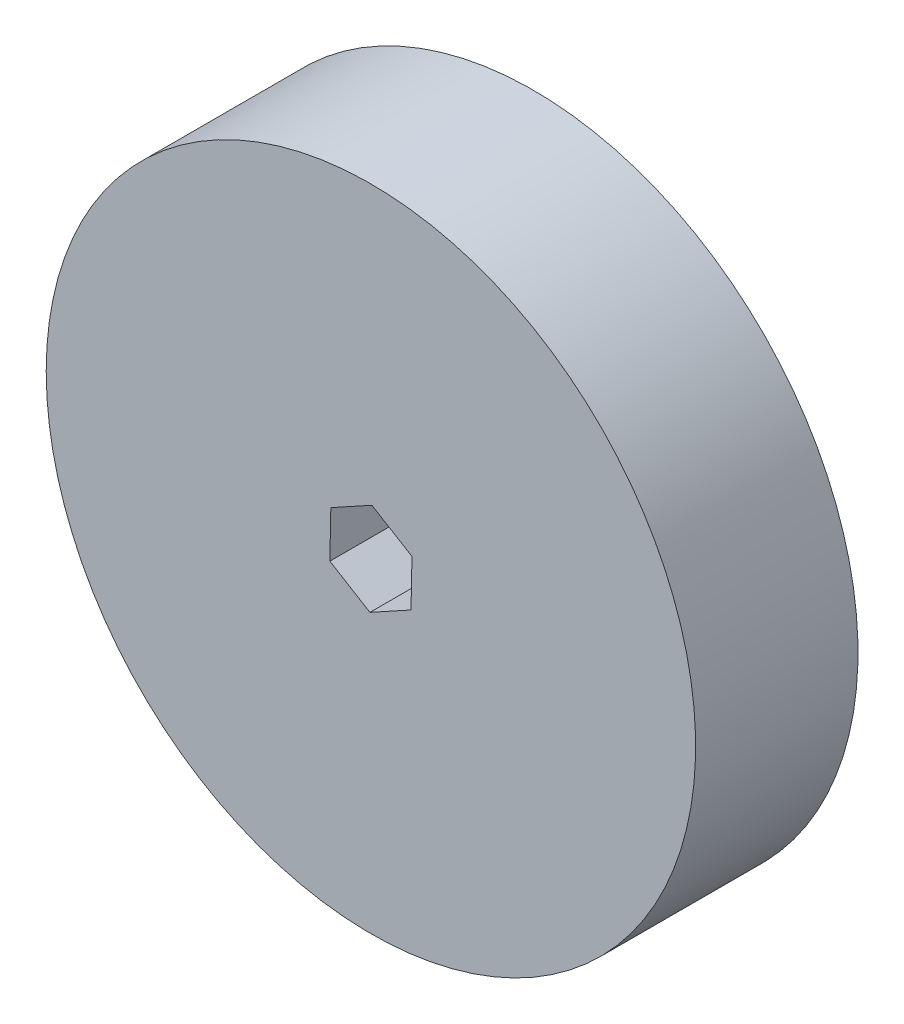
from build123d import *

# Parameters (mm, degrees)
SKETCH1_R           = 38.1
BOSS_EXTRUDE1_DEPTH = 19.05


with BuildPart() as part:
    # Sketch1 → Boss-Extrude1 (new body)
    with BuildSketch(Plane.XY):
        Circle(SKETCH1_R)
        Polygon((4.818540249, 2.650197137), (0.114132079, 5.498076834), (-4.70440817, 2.847879697), (-4.818540249, -2.650197137), (-0.114132079, -5.498076834), (4.70440817, -2.847879697), align=None, mode=Mode.SUBTRACT)
    extrude(amount=BOSS_EXTRUDE1_DEPTH)


solid = part.part
